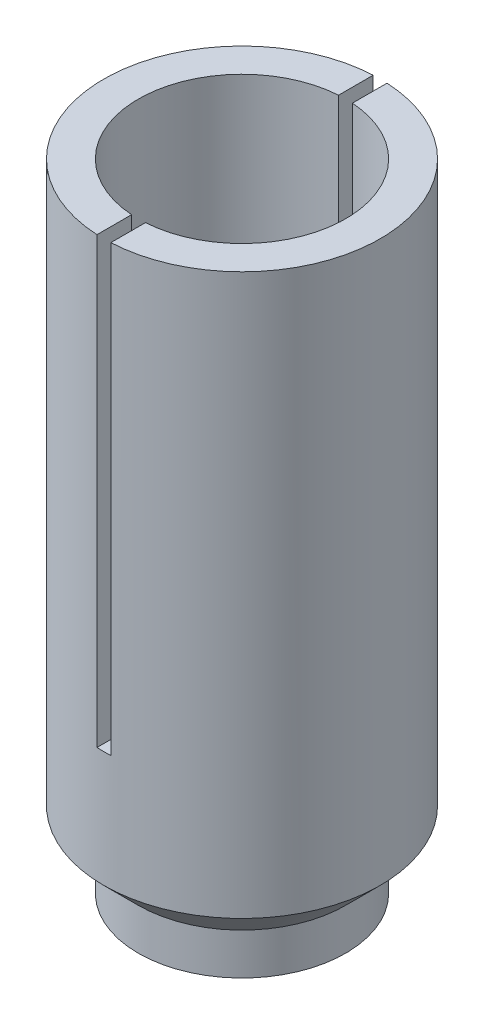
from build123d import *

# Parameters (mm, degrees)
SKETCH1_R               = 3.75
SKETCH1_R_2             = 2.5
BOSS_EXTRUDE1_DEPTH     = 3
SKETCH2_R               = 5
SKETCH2_R_2             = 1.25
BOSS_EXTRUDE2_DEPTH     = 20
CUT_EXTRUDE1_START      = -19
SKETCH3_R               = 3.75
CUT_EXTRUDE1_DEPTH      = 19
CHAMFER1_SIZE           = 1.5
CUT_EXTRUDE2_DEPTH      = 25.062418831
CUT_EXTRUDE2_DEPTH_BACK = 25.062418831
SKETCH4_W               = 0.5
SKETCH4_H               = 32.118567902


with BuildPart() as part:
    # Sketch1 → Boss-Extrude1 (new body)
    with BuildSketch(Plane(origin=(0, 0, 0), x_dir=(1, 0, 0), z_dir=(0, 1, 0))):
        with Locations(Location((0, 0, 0), (0, 0, 270))):
            Circle(SKETCH1_R)
        with Locations(Location((0, 0, 0), (0, 0, 270))):
            Circle(SKETCH1_R_2, mode=Mode.SUBTRACT)
    extrude(amount=BOSS_EXTRUDE1_DEPTH)

    # Sketch2 → Boss-Extrude2 (add)
    with BuildSketch(Plane(origin=(0, 3, 0), x_dir=(1, 0, 0), z_dir=(0, 1, 0))):
        with Locations(Location((0, 0, 0), (0, 0, 270))):
            Circle(SKETCH2_R)
        with Locations(Location((0, 0, 0), (0, 0, 270))):
            Circle(SKETCH2_R_2, mode=Mode.SUBTRACT)
    extrude(amount=BOSS_EXTRUDE2_DEPTH)

    # Sketch3 → Cut-Extrude1 (cut)
    with BuildSketch(Plane(origin=(0, 23, 0), x_dir=(1, 0, 0), z_dir=(0, 1, 0)).offset(CUT_EXTRUDE1_START)):
        with Locations(Location((0, 0, 0), (0, 0, 270))):
            Circle(SKETCH3_R)
    extrude(amount=CUT_EXTRUDE1_DEPTH, mode=Mode.SUBTRACT)

    # Chamfer1
    # the kernel refuses this chamfer: 1.5 mm, written as the material it adds along each edge
    with BuildSketch(Plane(origin=(0, 3, 0), x_dir=(0, 0, 1), z_dir=(-1, 0, 0))) as chamfer1_piece_1_section:
        Polygon((3.75 + CHAMFER1_SIZE, 0), (3.75, -CHAMFER1_SIZE), (3.75, 0), align=None)
    chamfer1_piece_1 = revolve(axis=Axis((0, 3, 0), (0, 1, 0)), mode=Mode.PRIVATE)
    chamfer1_piece_1 = chamfer1_piece_1 & Plane(origin=(0, 2.126111001, 0), x_dir=(0, 0, 1), z_dir=(0, -1, 0)) * Cylinder(5, 22, mode=Mode.PRIVATE)
    add(chamfer1_piece_1)
    with BuildSketch(Plane(origin=(0, 4, 0), x_dir=(0, 0, 1), z_dir=(-1, 0, 0))) as chamfer1_piece_2:
        Polygon((3.75, CHAMFER1_SIZE), (3.75 - CHAMFER1_SIZE, 0), (3.75, 0), align=None)
    revolve(axis=Axis((0, 4, 0), (0, 1, 0)))

    # Sketch4 → Cut-Extrude2 (cut, two sides: drawn at the far end of the back side and taken through both)
    with BuildSketch(Plane.XY.offset(-CUT_EXTRUDE2_DEPTH_BACK)):
        with Locations((0, 23)):
            Rectangle(SKETCH4_W, SKETCH4_H)
    extrude(amount=CUT_EXTRUDE2_DEPTH + CUT_EXTRUDE2_DEPTH_BACK, mode=Mode.SUBTRACT)


solid = part.part
